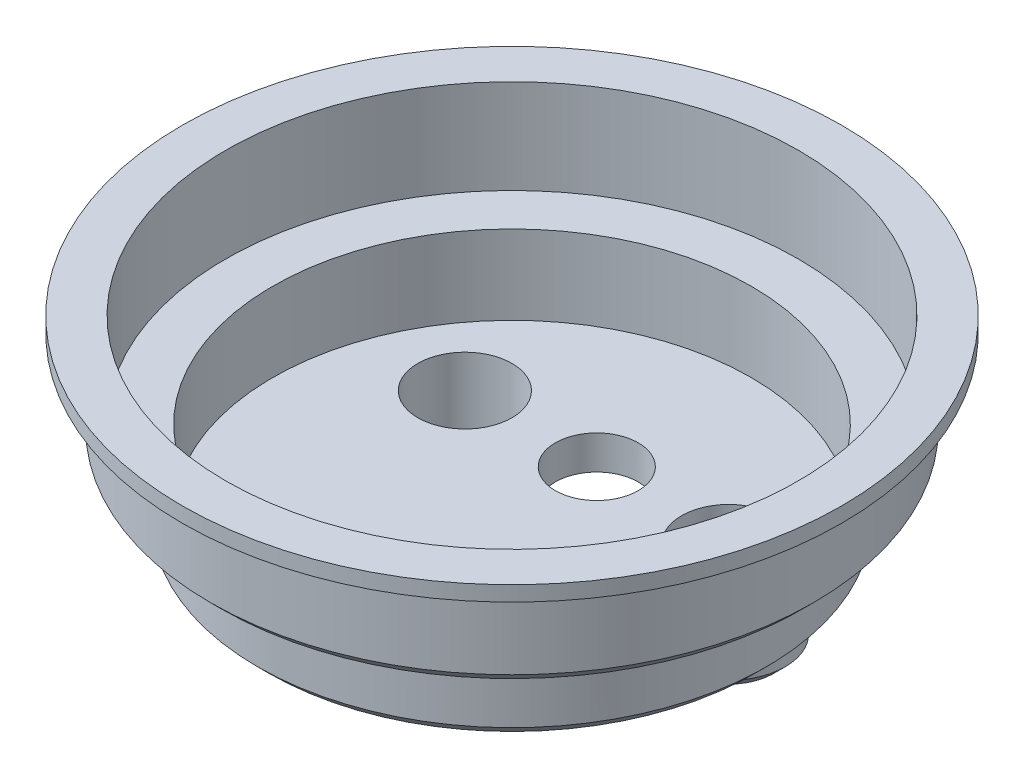
from build123d import *

# Parameters (mm, degrees)
SKETCH1_R            = 67.5
BOSS_EXTRUDE1_DEPTH  = 21
SKETCH3_R            = 80
BOSS_EXTRUDE2_DEPTH  = 25
SKETCH4_R            = 87.5
BOSS_EXTRUDE3_DEPTH  = 4
SHELL1_START         = 4
SHELL1_OUTLINE_R     = 63.5
SHELL1_DEPTH         = 46
SHELL1_START_2       = 25
SHELL1_2_OUTLINE_R   = 76
SHELL1_2_OUTLINE_R_2 = 63.5
SHELL1_2_DEPTH       = 25
SKETCH2_R            = 11
SKETCH2_R_2          = 6.25
CUT_EXTRUDE1_DEPTH   = 10
SKETCH5_R            = 15
SKETCH5_R_2          = 6.25
BOSS_EXTRUDE4_DEPTH  = 20
SKETCH6_R            = 12.5
CUT_EXTRUDE2_DEPTH   = 20
CHAMFER1_SIZE        = 3
CHAMFER2_SIZE        = 3
SKETCH7_R            = 15
SKETCH7_R_2          = 11
BOSS_EXTRUDE5_DEPTH  = 5


# Read off the part's stored shape, not the designer's step: Shell1
with BuildPart() as part:
    # Sketch1 → Boss-Extrude1 (new body)
    with BuildSketch(Plane(origin=(0, 0, 0), x_dir=(1, 0, 0), z_dir=(0, 1, 0))):
        with Locations(Location((0, 0, 0), (0, 0, 90))):
            Circle(SKETCH1_R)
    extrude(amount=BOSS_EXTRUDE1_DEPTH)

    # Sketch3 → Boss-Extrude2 (add)
    with BuildSketch(Plane(origin=(0, 21, 0), x_dir=(1, 0, 0), z_dir=(0, 1, 0))):
        with Locations(Location((0, 0, 0), (0, 0, 270))):
            Circle(SKETCH3_R)
    extrude(amount=BOSS_EXTRUDE2_DEPTH)

    # Sketch4 → Boss-Extrude3 (add)
    with BuildSketch(Plane(origin=(0, 46, 0), x_dir=(1, 0, 0), z_dir=(0, 1, 0))):
        with Locations(Location((0, 0, 0), (0, 0, 270))):
            Circle(SKETCH4_R)
    extrude(amount=BOSS_EXTRUDE3_DEPTH)

    # Shell1 outline → Shell1 (cut)
    with BuildSketch(Plane(origin=(0, 0, 0), x_dir=(1, 0, 0), z_dir=(0, 1, 0)).offset(SHELL1_START)):
        Circle(SHELL1_OUTLINE_R)
    extrude(amount=SHELL1_DEPTH, mode=Mode.SUBTRACT)

    # Shell1 2 outline → Shell1 2 (cut)
    with BuildSketch(Plane(origin=(0, 0, 0), x_dir=(1, 0, 0), z_dir=(0, 1, 0)).offset(SHELL1_START_2)):
        Circle(SHELL1_2_OUTLINE_R)
        Circle(SHELL1_2_OUTLINE_R_2, mode=Mode.SUBTRACT)
    extrude(amount=SHELL1_2_DEPTH, mode=Mode.SUBTRACT)

    # Sketch2 → Cut-Extrude1 (cut)
    with BuildSketch(Plane(origin=(0, 4, 0), x_dir=(1, 0, 0), z_dir=(0, 1, 0))):
        with Locations(Location((0, 22.5, 0), (0, 0, 270))):
            Circle(SKETCH2_R)
        with Locations(Location((-35, 22.5, 0), (0, 0, 270))):
            Circle(SKETCH2_R_2)
        with Locations(Location((35, 22.5, 0), (0, 0, 270))):
            Circle(SKETCH2_R_2)
    extrude(amount=-CUT_EXTRUDE1_DEPTH, mode=Mode.SUBTRACT)

    # Sketch5 → Boss-Extrude4 (add)
    # profile 1 of 2: a face of its own
    with BuildSketch(Plane.XZ):
        with Locations(Location((35, -22.5, 0), (0, 0, 90))):
            Circle(SKETCH5_R)
        with Locations(Location((35, -22.5, 0), (0, 0, 90))):
            Circle(SKETCH5_R_2, mode=Mode.SUBTRACT)
    # profile 2 of 2: a face of its own
    with BuildSketch(Plane.XZ):
        with Locations(Location((-35, -22.5, 0), (0, 0, 90))):
            Circle(SKETCH5_R)
        with Locations(Location((-35, -22.5, 0), (0, 0, 90))):
            Circle(SKETCH5_R_2, mode=Mode.SUBTRACT)
    extrude(amount=BOSS_EXTRUDE4_DEPTH)

    # Sketch6 → Cut-Extrude2 (cut)
    with BuildSketch(Plane(origin=(0, 4, 0), x_dir=(1, 0, 0), z_dir=(0, 1, 0))):
        with Locations(Location((-35, 22.5, 0), (0, 0, 270))):
            Circle(SKETCH6_R)
        with Locations(Location((35, 22.5, 0), (0, 0, 270))):
            Circle(SKETCH6_R)
    extrude(amount=-CUT_EXTRUDE2_DEPTH, mode=Mode.SUBTRACT)

    # Chamfer1
    chamfer1_edges = [part.edges().sort_by_distance(p)[0] for p in [
        (0, 0, 67.5),
        (0, 21, -80),
    ]]
    chamfer(chamfer1_edges, length=CHAMFER1_SIZE)

    # Chamfer2
    chamfer2_edges = [part.edges().sort_by_distance(p)[0] for p in [
        (35, -20, -37.5),
        (-35, -20, -37.5),
    ]]
    chamfer(chamfer2_edges, length=CHAMFER2_SIZE)

    # Sketch7 → Boss-Extrude5 (add)
    with BuildSketch(Plane.XZ):
        with Locations(Location((0, -22.5, 0), (0, 0, 90))):
            Circle(SKETCH7_R)
        with Locations(Location((0, -22.5, 0), (0, 0, 90))):
            Circle(SKETCH7_R_2, mode=Mode.SUBTRACT)
    extrude(amount=BOSS_EXTRUDE5_DEPTH)


solid = part.part
